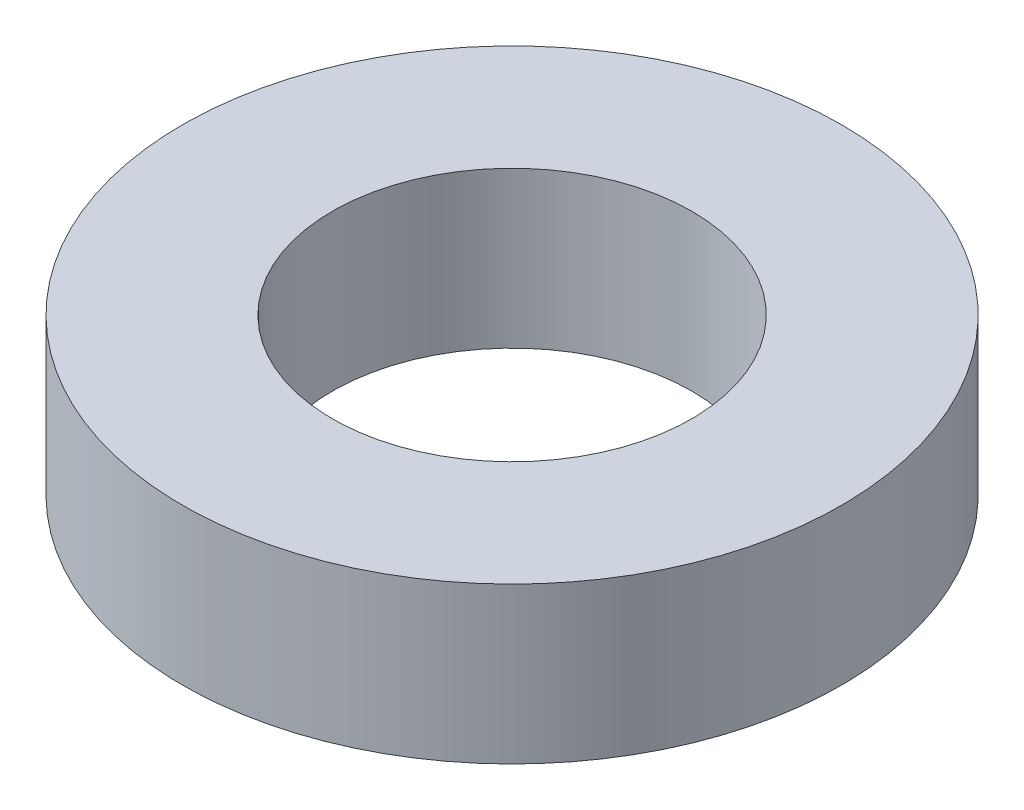
from build123d import *

# Parameters (mm, degrees)
SKETCH1_R           = 27.5
BOSS_EXTRUDE1_DEPTH = 13
SKETCH2_R           = 15
CUT_EXTRUDE1_DEPTH  = 42.006097108


with BuildPart() as part:
    # Sketch1 → Boss-Extrude1 (new body)
    with BuildSketch(Plane(origin=(0, 0, 0), x_dir=(1, 0, 0), z_dir=(0, 1, 0))):
        Circle(SKETCH1_R)
    extrude(amount=BOSS_EXTRUDE1_DEPTH)

    # Sketch2 → Cut-Extrude1 (cut, through all)
    with BuildSketch(Plane(origin=(0, 0, 0), x_dir=(1, 0, 0), z_dir=(0, 1, 0))):
        Circle(SKETCH2_R)
    extrude(amount=CUT_EXTRUDE1_DEPTH, mode=Mode.SUBTRACT)


solid = part.part
